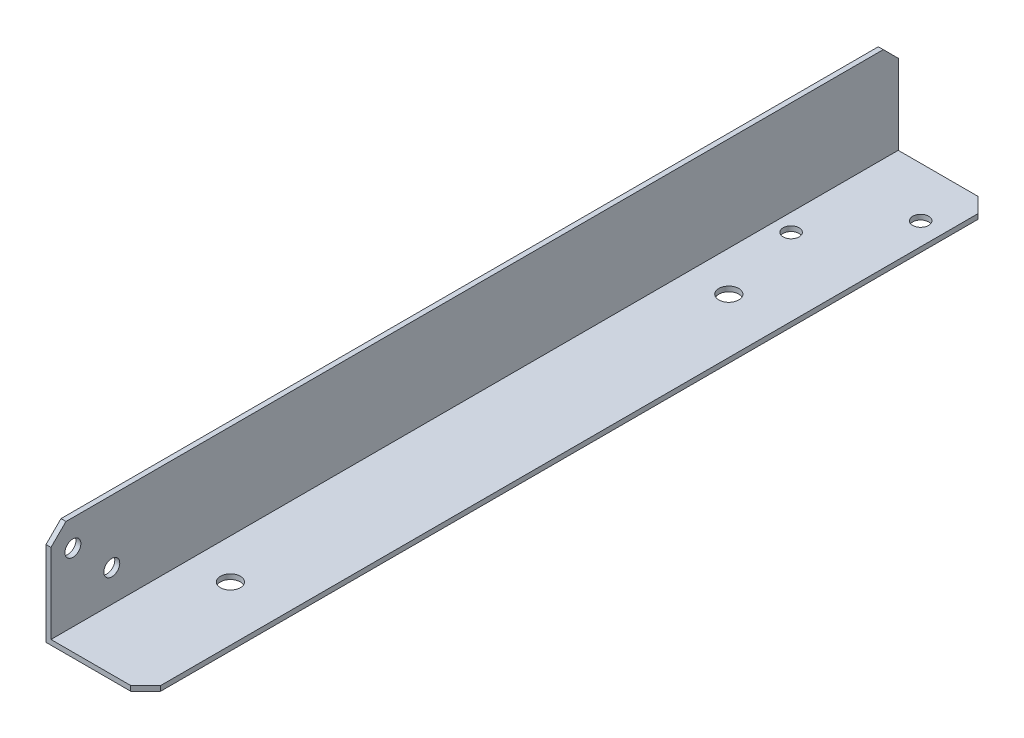
from build123d import *

# Parameters (mm, degrees)
BASE_DEPTH                      = 170
CHAMFEREDGES_SIZE               = 3
F_4_0_4_CABLE_TIE_HOLES_D       = 4
F_3_1_3_1_CABLECHAINSIDEHOLES_D = 3.2
F_3_2_3_2_CARRIAGESIDE_D        = 3.2


with BuildPart() as part:
    # Sketch1 → Base (new body)
    with BuildSketch(Plane.XY):
        Polygon((0, 0), (20, 0), (20, 1), (1, 1), (1, 20), (0, 20), align=None)
    extrude(amount=BASE_DEPTH)

    # ChamferEdges
    chamferedges_edges = [part.edges().sort_by_distance(p)[0] for p in [
        (20, 0.5, 170),
        (0.5, 20, 170),
        (0.5, 20, 0),
        (20, 0.5, 0),
    ]]
    chamfer(chamferedges_edges, length=CHAMFEREDGES_SIZE)

    # Ø4.0 (4) Cable tie Holes (through all)
    with Locations(Plane(origin=(0, 1, 0), x_dir=(1, 0, 0), z_dir=(0, 1, 0))):
        with Locations((9, -42), (9, -142)):
            Hole(F_4_0_4_CABLE_TIE_HOLES_D / 2)

    # Ø3.1 (3.1) CableChainSideHoles (through all)
    with Locations(Plane(origin=(1, 0, 0), x_dir=(0, 0, -1), z_dir=(1, 0, 0))):
        with Locations((-165.6, 14.68), (-157.8, 7.38)):
            Hole(F_3_1_3_1_CABLECHAINSIDEHOLES_D / 2)

    # Ø3.2 (3.2) CarriageSide (through all)
    with Locations(Plane(origin=(0, 1, 0), x_dir=(1, 0, 0), z_dir=(0, 1, 0))):
        with Locations((15.5, -10), (4.5, -25)):
            Hole(F_3_2_3_2_CARRIAGESIDE_D / 2)


solid = part.part
